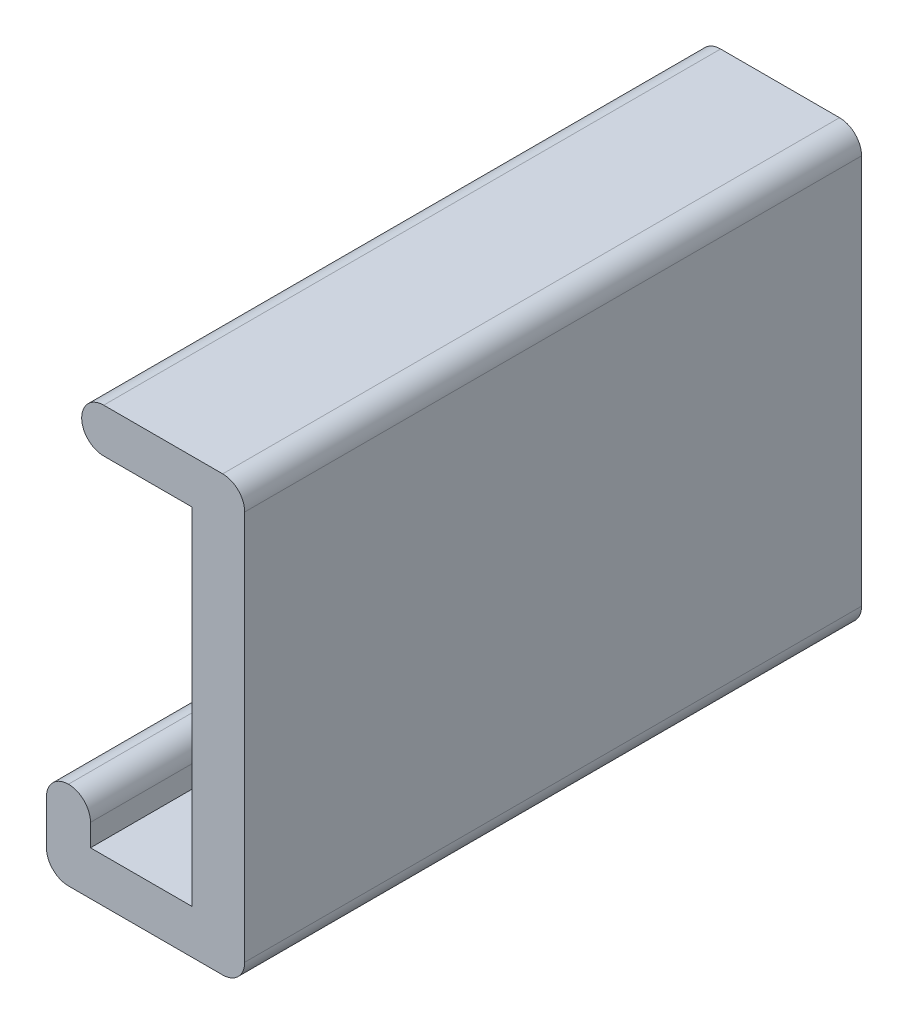
from build123d import *

# Parameters (mm, degrees)
SKETCH1_W           = 1
SKETCH1_H           = 1
BOSS_EXTRUDE1_DEPTH = 14
FILLET1_R           = 0.5


with BuildPart() as part:
    # Sketch1 → Boss-Extrude1 (new body)
    with BuildSketch(Plane.XY):
        Polygon((0, 4.925), (-3.7, 4.925), (-3.7, 3.925), (-1.2, 3.925), (-1.2, 0), (0, 0), align=None)
        Polygon((0, -4.925), (0, 0), (-1.2, 0), (-1.2, -3.925), (-3.5, -3.925), (-4.5, -3.925), (-4.5, -4.925), align=None)
        with Locations((-4, -3.425)):
            Rectangle(SKETCH1_W, SKETCH1_H)
    extrude(amount=BOSS_EXTRUDE1_DEPTH)

    # Fillet1
    fillet1_edges = [part.edges().sort_by_distance(p)[0] for p in [
        (0, -4.925, 7),
        (-4.5, -4.925, 7),
        (-4.5, -2.925, 7),
        (-3.5, -2.925, 7),
        (-3.7, 3.925, 7),
        (-3.7, 4.925, 7),
        (0, 4.925, 7),
    ]]
    fillet(fillet1_edges, radius=FILLET1_R - 0.0001)  # a hair under: the kernel refuses the full size


solid = part.part
